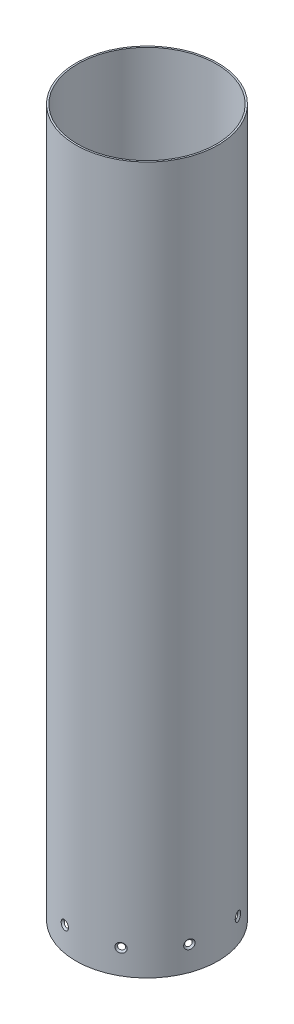
from build123d import *

# Parameters (mm, degrees)
SKETCH1_R           = 87
SKETCH1_R_2         = 85
BOSS_EXTRUDE1_DEPTH = 865
CUT_EXTRUDE1_REACH  = 888.606
SKETCH2_R           = 2.75
CIRPATTERN1_COUNT   = 9


with BuildPart() as part:
    # Sketch1 → Boss-Extrude1 (new body)
    with BuildSketch(Plane(origin=(0, 0, 0), x_dir=(1, 0, 0), z_dir=(0, 1, 0))):
        Circle(SKETCH1_R)
        Circle(SKETCH1_R_2, mode=Mode.SUBTRACT)
    extrude(amount=BOSS_EXTRUDE1_DEPTH)

    # Sketch2 → Cut-Extrude1 (cut, up to next)
    with BuildSketch(Plane.ZY.offset(87), mode=Mode.PRIVATE) as cut_extrude1_sk1:
        with Locations((0, 30)):
            Circle(SKETCH2_R)
    cut_extrude1_tool1 = extrude(cut_extrude1_sk1.sketch, amount=-CUT_EXTRUDE1_REACH, mode=Mode.PRIVATE) & part.part
    add(cut_extrude1_tool1.solids().sort_by_distance((-87, 30, 0))[0], mode=Mode.SUBTRACT)

    # Sketch4 → Cut-Revolve1 (revolve, cut)
    with BuildSketch(Plane.XZ.offset(-30)):
        Polygon((-86.355370418, -5), (-81.355370418, 0), (-86.355370418, 0), (-87.969003707, 0), (-87.969003707, -6.613633289), align=None)
    cut_revolve1 = revolve(axis=Axis((-93.993729437, 30, 0), (1, 0, 0)), mode=Mode.SUBTRACT)

    # CirPattern1: Cut-Revolve1 ×9 about axis
    cirpattern1_axis = Axis((0, 0, 0), (0, 1, 0))
    for i in range(1, CIRPATTERN1_COUNT):
        add(cut_revolve1.rotate(cirpattern1_axis, i * 360 / CIRPATTERN1_COUNT), mode=Mode.SUBTRACT)


solid = part.part
